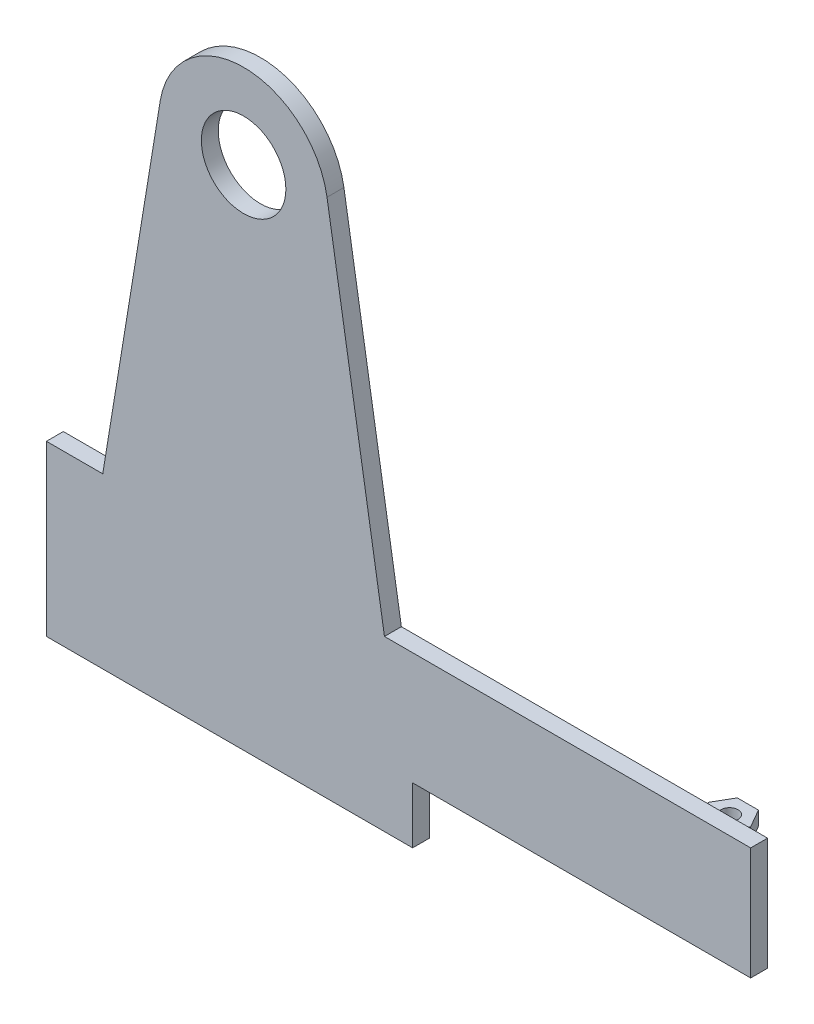
from build123d import *

# Parameters (mm, degrees)
EXTRUDE_1_DEPTH = 6
SKETCH_2_R      = 15
EXTRUDE_2_DEPTH = 6
SKETCH_3_R      = 3
EXTRUDE_3_DEPTH = 5


with BuildPart() as part:
    # Эскиз1 → Бобышка-Вытянуть1 (new body)
    with BuildSketch(Plane.XY):
        Polygon((-65, 0), (-65, 60), (185, 60), (185, 20), (65, 20), (65, 0), align=None)
    extrude(amount=-EXTRUDE_1_DEPTH)

    # Эскиз2 → Бобышка-Вытянуть2 (add)
    with BuildSketch(Plane.XY):
        with BuildLine():
            Line((-45, 60), (-24.607572962, 184.836488734))
            ThreePointArc((-24.607572962, 184.836488734), (5, 210), (34.607572962, 184.836488734))
            Line((34.607572962, 184.836488734), (55, 60))
            Line((55, 60), (-45, 60))
        make_face()
        with Locations((5, 180)):
            Circle(SKETCH_2_R, mode=Mode.SUBTRACT)
    extrude(amount=-EXTRUDE_2_DEPTH)


with BuildPart() as body_2:
    # Эскиз3 → Бобышка-Вытянуть3 (new body)
    with BuildSketch(Plane(origin=(0, 54, 0), x_dir=(1, 0, 0), z_dir=(0, 1, 0))):
        Polygon((157.494446501, 12.5), (161.24722325, 6), (168.75277675, 6), (172.505553499, 12.5), (168.75277675, 19), (161.24722325, 19), align=None)
        with Locations((165, 12.5)):
            Circle(SKETCH_3_R, mode=Mode.SUBTRACT)
    extrude(amount=-EXTRUDE_3_DEPTH)


with BuildPart() as body_3:
    # Зеркальное отражение1: mirrored copy
    add(body_2.part.mirror(Plane(origin=(60, 0, 0), x_dir=(0, 0, 1), z_dir=(1, 0, 0))))


solid = Compound([part.part, body_2.part, body_3.part])
